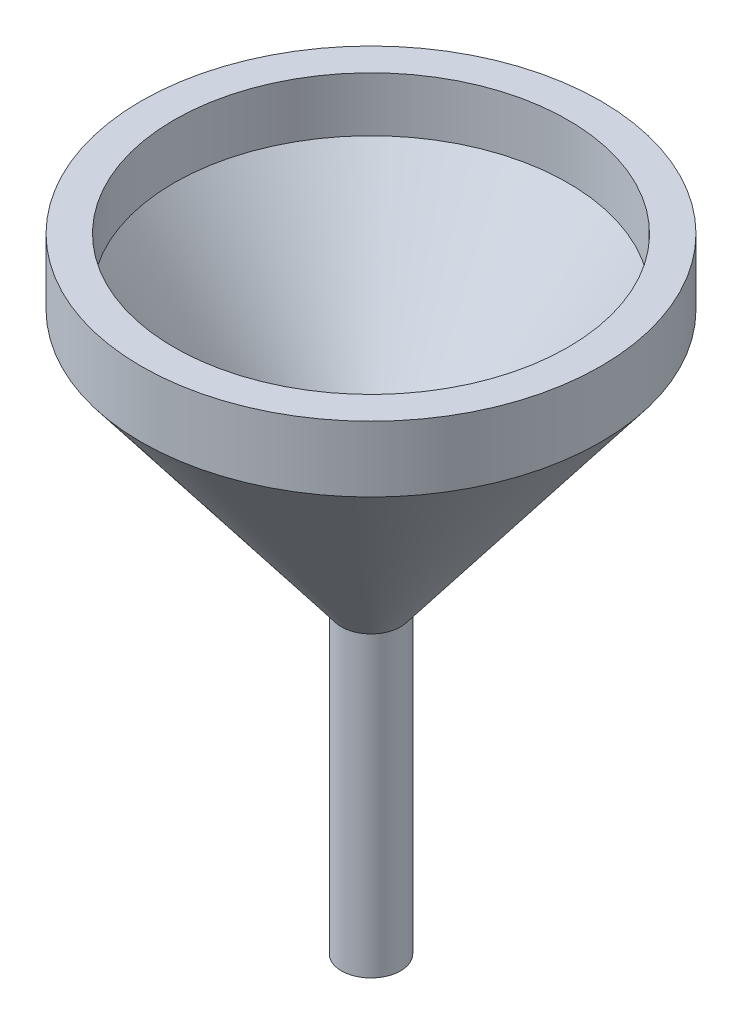
from build123d import *

# Parameters (mm, degrees)
CROQUIS2_R            = 6.249824167
CORTAR_EXTRUIR1_DEPTH = 150


# Read off the part's stored shape, not the designer's step: Vaciado4
with BuildPart() as part:
    # Croquis1 → Revolución2 (revolve)
    with BuildSketch(Plane.XY, mode=Mode.PRIVATE) as revoluci_n2_sk:
        Polygon((0, 95), (0, -95), (9, -95), (9, -4.240141343), (70, 75), (70, 95), align=None)
    revolve(revoluci_n2_sk.sketch.rotate(Axis((0, 95, 0), (0, -1, 0)), 180), axis=Axis((0, 95, 0), (0, -1, 0)))

    # Vaciado4 outline → Vaciado4 (revolve, cut)
    with BuildSketch(Plane.XY):
        Polygon((0, 95), (0, 0.462132886), (60, 78.403255518), (60, 95), align=None)
    revolve(axis=Axis((0, 0, 0), (0, 1, 0)), mode=Mode.SUBTRACT)

    # Croquis2 → Cortar-Extruir1 (cut)
    with BuildSketch(Plane.XZ.offset(95)):
        Circle(CROQUIS2_R)
    extrude(amount=-CORTAR_EXTRUIR1_DEPTH, mode=Mode.SUBTRACT)


solid = part.part
